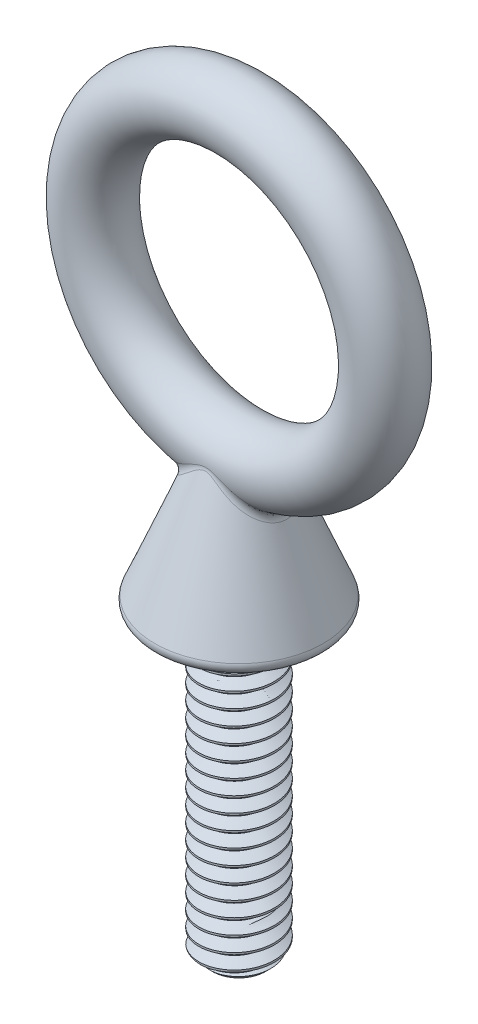
from build123d import *
from build123d.topology import SkipClean

# Parameters (mm, degrees)
BOSS_EXTRUDE1_START = -23.8125
SKETCH2_R           = 3.175
BOSS_EXTRUDE1_DEPTH = 25.4
SKETCH5_OUTSIDE_W   = 67.326
SKETCH5_OUTSIDE_H   = 67.326
SKETCH5_OUTSIDE_R   = 2.21262927
CUT_EXTRUDE1_DEPTH  = 26.793821935
CUT_EXTRUDE1_DRAFT  = -45
SKETCH6_R           = 2.778125
FILLET1_R           = 0.69453125
CUT_SWEEP1_PITCH    = 1.27
CUT_SWEEP1_TO       = 25.4
SKETCH9_R           = 3.175
BOSS_EXTRUDE2_DEPTH = 2.54
BOSS_EXTRUDE2_TAPER = 45


with BuildPart() as part:
    # Sketch2 → Boss-Extrude1 (new body)
    with BuildSketch(Plane(origin=(0, 0, 0), x_dir=(1, 0, 0), z_dir=(0, 1, 0)).offset(BOSS_EXTRUDE1_START)):
        with Locations(Location((0, 0, 0), (0, 0, 270))):
            Circle(SKETCH2_R)
    extrude(amount=-BOSS_EXTRUDE1_DEPTH)


with BuildPart() as cut_extrude1_tool:
    # Sketch5 outside → Cut-Extrude1 (with draft: the straight prism first)
    with BuildSketch(Plane.XZ.offset(49.2125)):
        Rectangle(SKETCH5_OUTSIDE_W, SKETCH5_OUTSIDE_H)
        Circle(SKETCH5_OUTSIDE_R, mode=Mode.SUBTRACT)
    extrude(amount=-CUT_EXTRUDE1_DEPTH)
    # Cut-Extrude1: the draft: its side faces are tilted about the plane it starts from
    cut_extrude1_sides = [cut_extrude1_tool.faces().sort_by_distance(p)[0] for p in [
        (0, -35.815589033, -33.663),
        (33.663, -35.815589033, 0),
        (0, -35.815589033, 33.663),
        (-33.663, -35.815589033, 0),
        (-2.21262927, -35.815589033, 0),
    ]]
    draft(cut_extrude1_sides, Plane.XZ.offset(49.2125), CUT_EXTRUDE1_DRAFT)


with BuildPart() as part_1:
    add(part.part)

    # Cut-Extrude1: cut by cut_extrude1_tool
    add(cut_extrude1_tool.part, mode=Mode.SUBTRACT)



with BuildPart() as body_2:
    # Sketch6 → Revolve1 (revolve)
    with BuildSketch(Plane(origin=(0, 0, 0), x_dir=(0, 0, -1), z_dir=(1, 0, 0)), mode=Mode.PRIVATE) as revolve1_sk:
        with Locations((0, 12.303125)):
            Circle(SKETCH6_R)
    revolve(revolve1_sk.sketch.rotate(Axis((0, 0, -7.63984375), (0, 0, 1)), 90), axis=Axis((0, 0, -7.63984375), (0, 0, 1)))


with BuildPart() as part_2:
    with SkipClean():  # the faces are left unmerged after this step: merging them gives an invalid solid
        add(part_1.part)

        add(body_2.part)  # Revolve2 merges body 2
        # Sketch8 → Revolve2 (revolve)
        with BuildSketch(Plane.XY, mode=Mode.PRIVATE) as revolve2_sk:
            with BuildLine():
                Line((0, -23.8125), (0, -12.303125))
                Line((0, -12.303125), (-2.778125, -12.303125))
                Line((-2.778125, -12.303125), (-7.092098939, -22.855140441))
                ThreePointArc((-7.092098939, -22.855140441), (-7.025810517, -23.505158098), (-6.44921875, -23.8125))
                Line((-6.44921875, -23.8125), (0, -23.8125))
            make_face()
        revolve(revolve2_sk.sketch.rotate(Axis((0, -23.8125, 0), (0, 1, 0)), 270), axis=Axis((0, -23.8125, 0), (0, 1, 0)))

    # Fillet1
    fillet1_edges = [part_2.edges().sort_by_distance(p)[0] for p in [
        (3.723072169, -14.614473483, -6e-09),
    ]]
    fillet(fillet1_edges, radius=FILLET1_R)


with BuildPart() as body_2_2:
    # Split1: the piece on the far side of the plane
    add(part_2.part)
    split(bisect_by=Plane(origin=(0, -23.8125, 0), x_dir=(-1, 0, 0), z_dir=(0, -1, 0)), keep=Keep.BOTTOM)


with BuildPart() as part_3:
    add(part_2.part)

    # Split1
    split(bisect_by=Plane(origin=(0, -23.8125, 0), x_dir=(-1, 0, 0), z_dir=(0, -1, 0)), keep=Keep.TOP)

    # Cut-Sweep1: arcs per turn and ends read off the stored shape
    # Cut-Sweep1: the profile of Sketch4 screwed along a right-hand helix through 22 turns, 8 arcs to a turn; built about Z, then put on its axis
    cut_sweep1_z = Axis((0, 0, 0), (0, 0, 1))
    cut_sweep1_corners = [(2.350110803, 0, -1.74625), (2.350110803, 0, -1.905), (3.243740766, 0, -2.4209375), (3.243740766, 0, -1.2303125)]
    with BuildLine(mode=Mode.PRIVATE) as cut_sweep1_profile:
        Line(cut_sweep1_corners[0], cut_sweep1_corners[1])
        Line(cut_sweep1_corners[1], cut_sweep1_corners[2])
        Line(cut_sweep1_corners[2], cut_sweep1_corners[3])
        Line(cut_sweep1_corners[3], cut_sweep1_corners[0])
    cut_sweep1_cap = Face(cut_sweep1_profile.wire())
    cut_sweep1_turn_angles = [0, 22.5, 45, 67.5, 90, 112.5, 135, 157.5, 180, 202.5, 225, 247.5, 270, 292.5, 315, 337.5, 360]
    cut_sweep1_turn_weights = [1, 0.9238795325112867, 1, 0.9238795325112867, 1, 0.9238795325112867, 1, 0.9238795325112867, 1, 0.9238795325112867, 1, 0.9238795325112867, 1, 0.9238795325112867, 1, 0.9238795325112867, 1]
    cut_sweep1_turn_rails = [Edge.make_bspline([Vector(p[0], p[1], 0).rotate(cut_sweep1_z, cut_sweep1_turn_angles[k]) / cut_sweep1_turn_weights[k] + Vector(0, 0, p[2] + CUT_SWEEP1_PITCH * cut_sweep1_turn_angles[k] / 360) for k in range(17)], [0, 0, 0, 1, 1, 2, 2, 3, 3, 4, 4, 5, 5, 6, 6, 7, 7, 8, 8, 8], 2, cut_sweep1_turn_weights) for p in cut_sweep1_corners]
    cut_sweep1_turn_sides = [Face.make_surface_from_curves(cut_sweep1_turn_rails[p[0]], cut_sweep1_turn_rails[p[1]]) for p in [(0, 1), (1, 2), (2, 3), (3, 0)]]
    cut_sweep1 = Plane(origin=(0, -49.2125, 0), x_dir=(1, 0, 0), z_dir=(0, 1, 0)) * split(Solid(Shell([*[p.moved(Location((0, 0, CUT_SWEEP1_PITCH * i))) for i in range(22) for p in cut_sweep1_turn_sides], cut_sweep1_cap, cut_sweep1_cap.rotate(cut_sweep1_z, 7920).moved(Location((0, 0, CUT_SWEEP1_PITCH * 7920 / 360)))])), bisect_by=Plane.XY.offset(CUT_SWEEP1_TO), keep=Keep.BOTTOM, mode=Mode.PRIVATE)
    add(cut_sweep1, mode=Mode.SUBTRACT)

    add(body_2_2.part)  # Boss-Extrude2 merges body 2 2
    # Sketch9 → Boss-Extrude2 (add)
    with BuildSketch(Plane.XZ.offset(23.8125)):
        Circle(SKETCH9_R)
    extrude(amount=BOSS_EXTRUDE2_DEPTH, taper=BOSS_EXTRUDE2_TAPER)


solid = part_3.part
